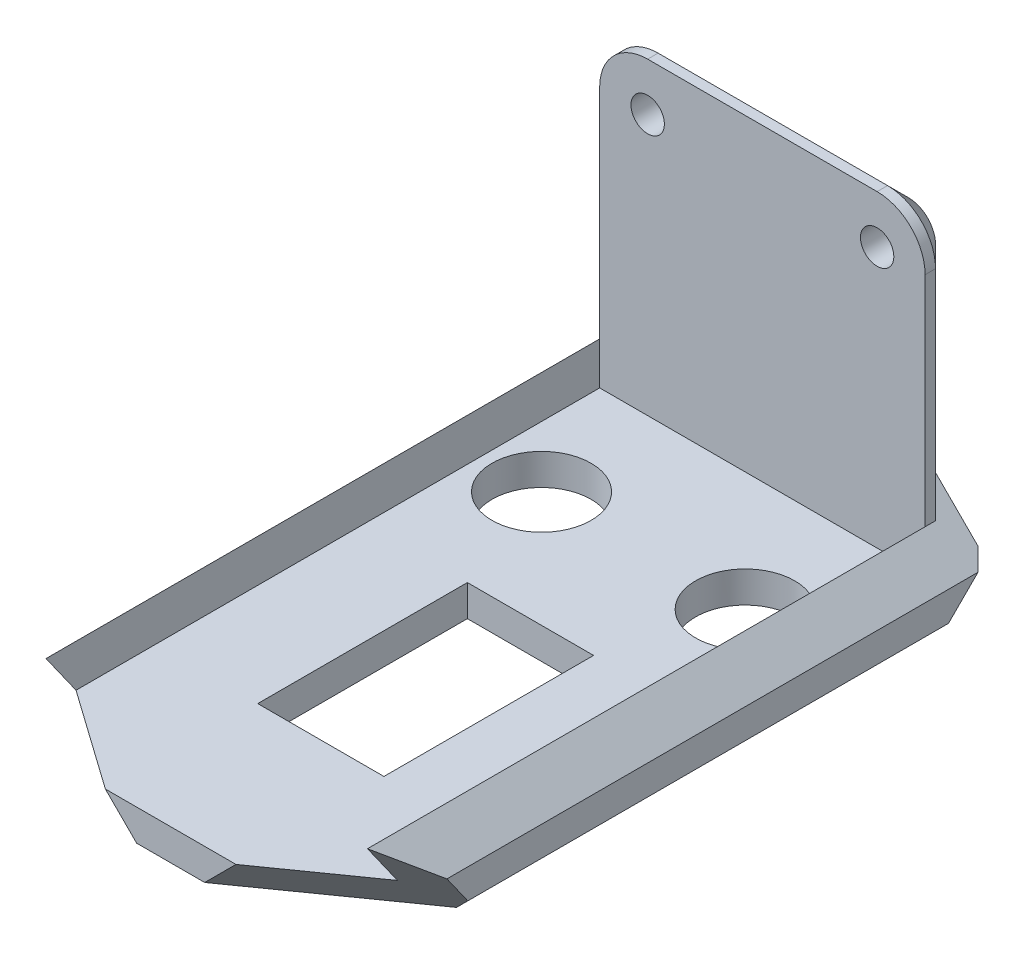
from build123d import *
from OCP.BRepFilletAPI import BRepFilletAPI_MakeChamfer

# Parameters (mm, degrees)
SKETCH1_R           = 1.6
BOSS_EXTRUDE1_DEPTH = 3
SKETCH3_W           = 31.2
SKETCH3_H           = 3
BOSS_EXTRUDE2_DEPTH = 60
BOSS_EXTRUDE3_DEPTH = 60
CHAMFER1_SIZE       = 5
CHAMFER1_SIZE2      = 3.535533906
CHAMFER2_SIZE       = 2
CHAMFER3_SIZE       = 2
CHAMFER4_SIZE       = 2
SKETCH5_W           = 12.1
SKETCH5_H           = 20.1
CUT_EXTRUDE1_DEPTH  = 30
SKETCH6_R           = 4.75
CUT_EXTRUDE2_DEPTH  = 30
CHAMFER5_SIZE       = 10


with BuildPart() as part:
    # Sketch1 → Boss-Extrude1 (new body)
    with BuildSketch(Plane.XY):
        with BuildLine():
            ThreePointArc((-11, 4.6), (-14.252691193, 3.252691193), (-15.6, 0))
            Line((-15.6, 0), (-15.6, -25))
            Line((-15.6, -25), (15.6, -25))
            Line((15.6, -25), (15.6, 0))
            ThreePointArc((15.6, 0), (14.252691193, 3.252691193), (11, 4.6))
            Line((11, 4.6), (-11, 4.6))
        make_face()
        with Locations((-11, 0)):
            Circle(SKETCH1_R, mode=Mode.SUBTRACT)
        with Locations((11, 0)):
            Circle(SKETCH1_R, mode=Mode.SUBTRACT)
    extrude(amount=BOSS_EXTRUDE1_DEPTH)

    # Sketch3 → Boss-Extrude2 (add)
    with BuildSketch(Plane(origin=(0, 0, 0), x_dir=(-1, 0, 0), z_dir=(0, 0, -1))):
        with Locations((0, -26.5)):
            Rectangle(SKETCH3_W, SKETCH3_H)
    extrude(amount=-BOSS_EXTRUDE2_DEPTH)

    # Sketch4 → Boss-Extrude3 (add)
    with BuildSketch(Plane(origin=(0, 0, 0), x_dir=(-1, 0, 0), z_dir=(0, 0, -1))):
        Polygon((-15.6, -28), (-15.6, -20.928932188), (-22.671067812, -28), align=None)
        Polygon((15.6, -20.928932188), (15.6, -28), (22.671067812, -28), align=None)
    extrude(amount=-BOSS_EXTRUDE3_DEPTH)

    # Chamfer1: one chamfer whose edges measure the first distance from different faces: ONE call of the kernel's chamfer builder (chamfer() names one face for all edges)
    chamfer1_edges_1 = [part.edges().sort_by_distance(p)[0] for p in [
        (0, -28, 0),
    ]]
    chamfer1_edges_2 = [part.edges().sort_by_distance(p)[0] for p in [
        (22.671067812, -28, 30),
    ]]
    chamfer1_side_2 = [part.faces().sort_by_distance(p)[0] for p in [
        (0, -28, 30),
    ]]
    chamfer1_edges_3 = [part.edges().sort_by_distance(p)[0] for p in [
        (-22.671067812, -28, 30),
    ]]
    chamfer1_side_3 = [part.faces().sort_by_distance(p)[0] for p in [
        (-19.135533906, -24.464466094, 30),
    ]]
    chamfer1 = BRepFilletAPI_MakeChamfer(part.part.solid().wrapped)
    for e in chamfer1_edges_1:
        chamfer1.Add(CHAMFER1_SIZE, e.wrapped)
    for e in chamfer1_edges_2:
        chamfer1.Add(CHAMFER1_SIZE, CHAMFER1_SIZE2, e.wrapped, chamfer1_side_2[0].wrapped)  # the first distance lies on this face
    for e in chamfer1_edges_3:
        chamfer1.Add(CHAMFER1_SIZE, CHAMFER1_SIZE2, e.wrapped, chamfer1_side_3[0].wrapped)  # the first distance lies on this face
    add(Compound.cast(chamfer1.Shape()), mode=Mode.REPLACE)

    # Chamfer2
    chamfer2_edges = [part.edges().sort_by_distance(p)[0] for p in [
        (14.252691193, 3.252691193, 0),
        (15.6, -10.464466094, 0),
        (-15.6, -10.464466094, 0),
        (-14.252691193, 3.252691193, 0),
        (0, 4.6, 0),
    ]]
    chamfer(chamfer2_edges, length=CHAMFER2_SIZE)

    # Chamfer3
    chamfer3_edges = [part.edges().sort_by_distance(p)[0] for p in [
        (-19.135533906, -28, 32.5),
    ]]
    chamfer(chamfer3_edges, length=CHAMFER3_SIZE)

    # Chamfer4
    chamfer4_edges = [part.edges().sort_by_distance(p)[0] for p in [
        (20.171067812, -25.5, 31.25),
    ]]
    chamfer(chamfer4_edges, length=CHAMFER4_SIZE)

    # Sketch5 → Cut-Extrude1 (cut)
    with BuildSketch(Plane.XZ.offset(28)):
        with Locations((0.267766953, 35.55312029)):
            Rectangle(SKETCH5_W, SKETCH5_H)
    extrude(amount=-CUT_EXTRUDE1_DEPTH, mode=Mode.SUBTRACT)

    # Sketch6 → Cut-Extrude2 (cut)
    with BuildSketch(Plane.XZ.offset(28)):
        with Locations((9.761183066, 14.413738274)):
            Circle(SKETCH6_R)
        with Locations(Location((-9.761183066, 14.413738274, 0), (0, 0, 270))):
            Circle(SKETCH6_R)
    extrude(amount=-CUT_EXTRUDE2_DEPTH, mode=Mode.SUBTRACT)

    # Chamfer5
    # the kernel refuses this chamfer: 10 mm, written as the material it takes off along each edge
    with BuildSketch(Plane(origin=(-37.320078704, -7.815455201, 60), x_dir=(-0.019442520806014, -0.01944252080601393, -0.9996219169112968), z_dir=(0.7071067811865462, -0.7071067811865488, 0))) as chamfer5_piece_1:
        Polygon((CHAMFER5_SIZE * 0.999621916911, CHAMFER5_SIZE * 0.0274958766106), (-CHAMFER5_SIZE * 0.0274958766106, CHAMFER5_SIZE * 0.999621916911), (0, 0), align=None)
    extrude(amount=54.262086884, mode=Mode.SUBTRACT)
    with BuildSketch(Plane(origin=(-0.513476987, -46.184544799, 60), x_dir=(0.019442520806014572, -0.019442520806014493, -0.9996219169112968), z_dir=(0.7071067811865461, 0.707106781186549, 0))) as chamfer5_piece_2:
        Polygon((CHAMFER5_SIZE * 0.999621916911, CHAMFER5_SIZE * 0.0274958766106), (-CHAMFER5_SIZE * 0.0274958766106, CHAMFER5_SIZE * 0.999621916911), (0, 0), align=None)
    extrude(amount=52.969193665, mode=Mode.SUBTRACT)


solid = part.part
